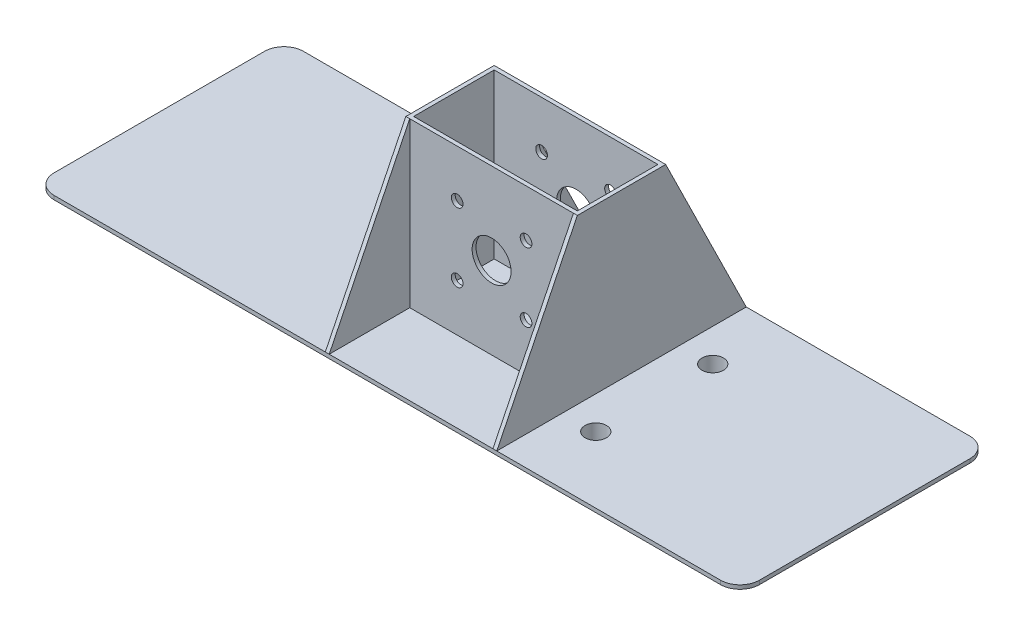
from build123d import *

# Parameters (mm, degrees)
BOSS_EXTRUDE1_DEPTH     = 1
SKETCH2_R               = 2.75
CUT_EXTRUDE1_DEPTH      = 96.996093671
SKETCH9_R               = 4.75
SKETCH9_R_2             = 2.75
BOSS_EXTRUDE4_DEPTH     = 6.5
SKETCH11_W              = 42
SKETCH11_H              = 20.666666666
BOSS_EXTRUDE6_DEPTH     = 42
CUT_EXTRUDE2_DEPTH      = 119.246183871
CUT_EXTRUDE2_DEPTH_BACK = 119.246183871
CUT_EXTRUDE3_DEPTH      = 110.165139938
CUT_EXTRUDE3_DEPTH_BACK = 110.165139938
SKETCH13_R              = 5
SKETCH13_R_2            = 1.5


with BuildPart() as part:
    # Sketch1 → Boss-Extrude1 (new body)
    with BuildSketch(Plane(origin=(0, 0, 0), x_dir=(1, 0, 0), z_dir=(0, 1, 0))):
        with BuildLine():
            Line((85.5, 32), (-85.5, 32))
            ThreePointArc((-85.5, 32), (-89.035533906, 30.535533906), (-90.5, 27))
            Line((-90.5, 27), (-90.5, -27))
            ThreePointArc((-90.5, -27), (-89.035533906, -30.535533906), (-85.5, -32))
            Line((-85.5, -32), (85.5, -32))
            ThreePointArc((85.5, -32), (89.035533906, -30.535533906), (90.5, -27))
            Line((90.5, -27), (90.5, 27))
            ThreePointArc((90.5, 27), (89.035533906, 30.535533906), (85.5, 32))
        make_face()
    extrude(amount=BOSS_EXTRUDE1_DEPTH)

    # Sketch2 → Cut-Extrude1 (cut, through all)
    with BuildSketch(Plane(origin=(0, 1, 0), x_dir=(1, 0, 0), z_dir=(0, 1, 0))):
        with Locations((36.5, -15)):
            Circle(SKETCH2_R)
        with Locations((36.5, 15)):
            Circle(SKETCH2_R)
        with Locations((-25.5, 0)):
            Circle(SKETCH2_R)
    extrude(amount=-CUT_EXTRUDE1_DEPTH, mode=Mode.SUBTRACT)

    # Sketch9 → Boss-Extrude4 (add)
    # profile 1 of 3: a face of its own
    with BuildSketch(Plane.XZ):
        with Locations((-25.5, 0)):
            Circle(SKETCH9_R)
        with Locations((-25.5, 0)):
            Circle(SKETCH9_R_2, mode=Mode.SUBTRACT)
    # profile 2 of 3: a face of its own
    with BuildSketch(Plane.XZ):
        with Locations((36.5, -15)):
            Circle(SKETCH9_R)
        with Locations((36.5, -15)):
            Circle(SKETCH9_R_2, mode=Mode.SUBTRACT)
    # profile 3 of 3: a face of its own
    with BuildSketch(Plane.XZ):
        with Locations((36.5, 15)):
            Circle(SKETCH9_R)
        with Locations((36.5, 15)):
            Circle(SKETCH9_R_2, mode=Mode.SUBTRACT)
    extrude(amount=BOSS_EXTRUDE4_DEPTH)

    # Sketch11 → Boss-Extrude6 (add)
    with BuildSketch(Plane(origin=(0, 1, 0), x_dir=(1, 0, 0), z_dir=(0, 1, 0))):
        Polygon((-15.9, 32), (-14.9, 32), (-14.9, 11.333333333), (27.1, 11.333333333), (27.1, 32), (28.1, 32), (28.1, -32), (27.1, -32), (27.1, -11.333333333), (-14.9, -11.333333333), (-14.9, -32), (-15.9, -32), align=None)
        with Locations((6.1, 0)):
            Rectangle(SKETCH11_W, SKETCH11_H, mode=Mode.SUBTRACT)
    extrude(amount=BOSS_EXTRUDE6_DEPTH)

    # Sketch12 → Cut-Extrude2 (cut, two sides: drawn at the far end of the back side and taken through both)
    with BuildSketch(Plane(origin=(-14.9, 0, 0), x_dir=(0, 0, -1), z_dir=(1, 0, 0)).offset(-CUT_EXTRUDE2_DEPTH_BACK)):
        Polygon((-11.333333333, 43), (-32, 1), (-32, 43), align=None)
        Polygon((11.333333333, 43), (32, 1), (32, 43), align=None)
    extrude(amount=CUT_EXTRUDE2_DEPTH + CUT_EXTRUDE2_DEPTH_BACK, mode=Mode.SUBTRACT)

    # Sketch13 → Cut-Extrude3 (cut, two sides: drawn at the far end of the back side and taken through both)
    with BuildSketch(Plane.XY.offset(11.333333333).offset(-CUT_EXTRUDE3_DEPTH_BACK)):
        with Locations((6.1, 22)):
            Circle(SKETCH13_R)
        with Locations((-2.738834765, 13.161165235)):
            Circle(SKETCH13_R_2)
        with Locations((-2.738834765, 30.838834765)):
            Circle(SKETCH13_R_2)
        with Locations((14.938834765, 13.161165235)):
            Circle(SKETCH13_R_2)
        with Locations((14.938834765, 30.838834765)):
            Circle(SKETCH13_R_2)
    extrude(amount=CUT_EXTRUDE3_DEPTH + CUT_EXTRUDE3_DEPTH_BACK, mode=Mode.SUBTRACT)


solid = part.part
